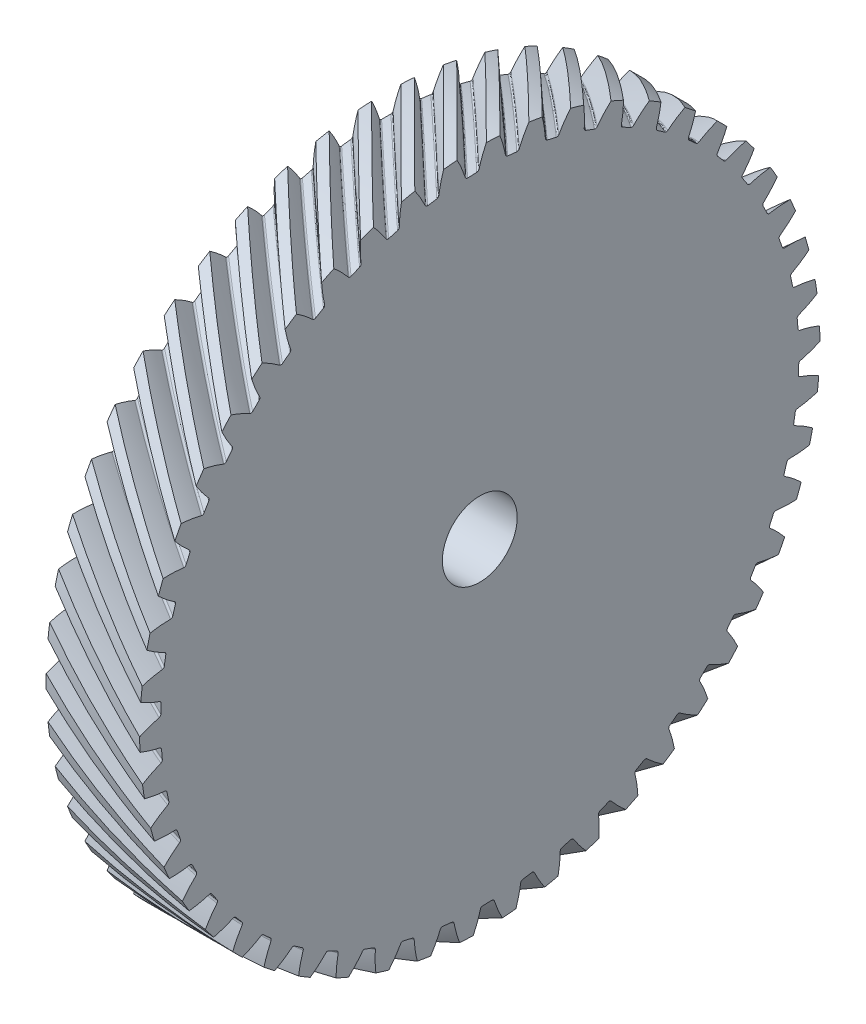
from build123d import *

# Parameters (mm, degrees)
BASPROSKE_W            = 25
BASPROSKE_H            = 90.888347648
TOOTHCUTRH_PITCH       = 571.068330538
TOOTHCUTRH_HEIGHT      = 25
TOOTHCUTRH_RADIUS      = 90.888347648
TOOTHCUTRH_START_ANGLE = -90
TEETHCUTSRH_COUNT      = 50
TEETHCUTSRH_ANGLE      = 352.8
BORSKE_R               = 10
BORE_DEPTH             = 62.5000025


with BuildPart() as part:
    # BasProSke → Base-Revolve (revolve)
    with BuildSketch(Plane(origin=(0, 0, 0), x_dir=(1, 0, 0), z_dir=(0, 1, 0)), mode=Mode.PRIVATE) as base_revolve_sk:
        with Locations((12.5, 45.444173824)):
            Rectangle(BASPROSKE_W, BASPROSKE_H)
    revolve(base_revolve_sk.sketch.rotate(Axis((-10, 0, 0), (1, 0, 0)), 180), axis=Axis((-10, 0, 0), (1, 0, 0)))

    # ToothCutRH: sweep along a helix
    with BuildLine() as toothcutrh_path:
        add(Helix(TOOTHCUTRH_PITCH, TOOTHCUTRH_HEIGHT, TOOTHCUTRH_RADIUS, center=(0, 0, 0), direction=(1, 0, 0), mode=Mode.PRIVATE).rotate(Axis((0, 0, 0), (1, 0, 0)), TOOTHCUTRH_START_ANGLE))
    # TooCutSkeRH → ToothCutRH (sweep, cut)
    with BuildSketch(Plane(origin=(0, 0, 0), x_dir=(0, 0, -1), z_dir=(1, 0, 0))):
        with BuildLine():
            ThreePointArc((1.239687688, 85.254334943), (0, 85.263347648), (-1.239687688, 85.254334943))
            ThreePointArc((-1.239687688, 85.254334943), (-1.618551609, 85.375143118), (-1.848206562, 85.699783053))
            ThreePointArc((-1.848206562, 85.699783053), (-3.358744719, 89.701278736), (-5.401525818, 93.45903586))
            ThreePointArc((-5.401525818, 93.45903586), (0, 93.614998078), (5.401525818, 93.45903586))
            ThreePointArc((5.401525818, 93.45903586), (3.358744719, 89.701278736), (1.848206562, 85.699783053))
            ThreePointArc((1.848206562, 85.699783053), (1.618551609, 85.375143118), (1.239687688, 85.254334943))
        make_face()
    toothcutrh = sweep(path=toothcutrh_path.line, is_frenet=True, mode=Mode.SUBTRACT)

    # TeethCutsRH: ToothCutRH ×50 about axis
    teethcutsrh_axis = Axis((-10, 0, 0), (1, 0, 0))
    for i in range(1, TEETHCUTSRH_COUNT):
        add(toothcutrh.rotate(teethcutsrh_axis, i * TEETHCUTSRH_ANGLE / (TEETHCUTSRH_COUNT - 1)), mode=Mode.SUBTRACT)

    # BorSke → Bore (cut, symmetric)
    with BuildSketch(Plane(origin=(0, 0, 0), x_dir=(0, 0, -1), z_dir=(1, 0, 0))):
        with Locations(Location((0, 0, 0), (0, 0, 180))):
            Circle(BORSKE_R)
    extrude(amount=BORE_DEPTH, both=True, mode=Mode.SUBTRACT)


solid = part.part
